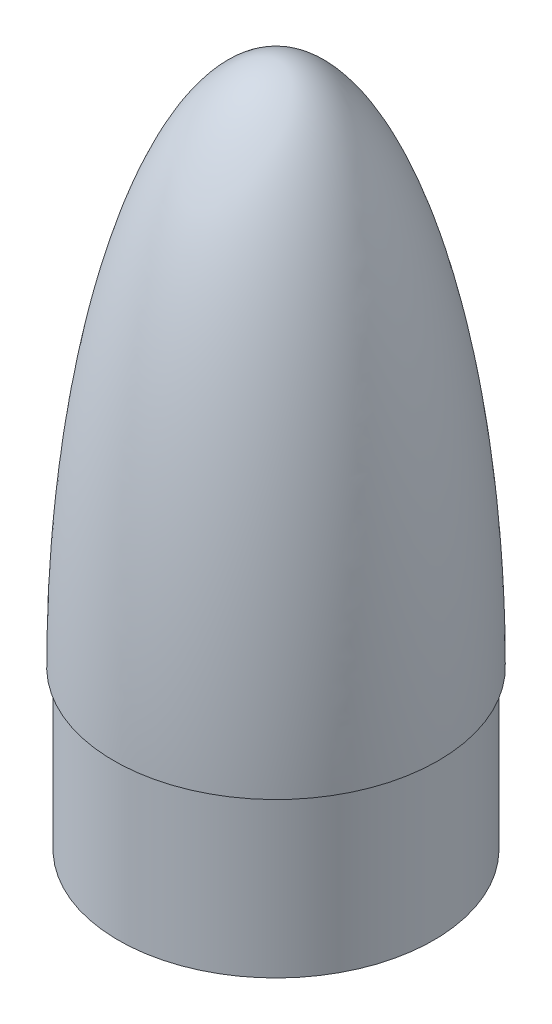
from build123d import *

# Parameters (mm, degrees)
SKETCH2_R           = 76.2
BOSS_EXTRUDE1_DEPTH = 76.2
SKETCH4_R           = 17.78
CUT_EXTRUDE1_DEPTH  = 96.52
CUT_EXTRUDE2_START  = 106.68
SKETCH5_R           = 8.255
CUT_EXTRUDE2_DEPTH  = 119.38
CUT_EXTRUDE3_START  = -25.4
SKETCH19_R          = 15.24
CUT_EXTRUDE3_DEPTH  = 101.6
SKETCH21_R          = 2.54
CUT_EXTRUDE4_DEPTH  = 6.35
SKETCH22_R          = 3
CUT_EXTRUDE5_DEPTH  = 12.7


with BuildPart() as part:
    # Sketch1 → Revolve1 (revolve)
    with BuildSketch(Plane.XY):
        with BuildLine():
            Line((78.359, 0), (0, 0))
            Line((0, 0), (0, 254))
            add(Edge.make_bspline(
                [(78.359, 0), (78.359, 0.547287489), (78.357845602, 1.649563618), (78.352650776, 3.586349875), (78.338796346, 5.988934596), (78.318010672, 8.352211569), (78.29028895, 10.745600888), (78.246958697, 13.731411826), (78.181061307, 17.311703382), (78.08386626, 21.490442467), (77.944822085, 26.264117007), (77.777683186, 31.037557631), (77.58229134, 35.809557456), (77.358460439, 40.580511863), (77.042853487, 46.542286246), (76.679080298, 52.501436144), (76.266448568, 58.457359127), (75.804102806, 64.409607399), (75.404015228, 69.168949637), (74.865626928, 75.114798701), (74.157385744, 82.243973993), (73.238266918, 90.551730955), (72.055740597, 100.030771811), (70.735528943, 109.491671534), (69.270929118, 118.931305028), (67.249996919, 130.699881306), (64.501732948, 144.763840427), (61.308555538, 158.735984092), (57.591049496, 172.577213574), (53.383025938, 186.275905479), (49.238746312, 198.044837449), (44.48323743, 209.587335711), (38.942884235, 220.71924179), (34.256173135, 228.693595393), (29.818710248, 235.095423042), (25.624249732, 240.182852143), (21.978892835, 243.926180276), (18.570150197, 246.859542723), (15.474349081, 249.076247661), (12.563405711, 250.785701438), (9.772327363, 252.083533871), (7.063069709, 253.028642362), (4.275373805, 253.686778481), (2.188006886, 253.939891173), (0.767171586, 253.999916555), (0, 254)],
                knots=[0.083290168, 0.083290168, 0.083290168, 0.083290168, 0.083290168, 0.091119674, 0.09894918, 0.106778686, 0.114608192, 0.122437698, 0.130267203, 0.145926215, 0.161585227, 0.177244239, 0.192903251, 0.208562263, 0.224221275, 0.239880287, 0.27119831, 0.286857322, 0.302516334, 0.318175346, 0.333834359, 0.365152383, 0.396470407, 0.42778843, 0.459106453, 0.490424474, 0.521742495, 0.584378539, 0.647014581, 0.678332609, 0.709650637, 0.772286631, 0.810589211, 0.841907031, 0.872607503, 0.893486158, 0.91262845, 0.928287274, 0.941044948, 0.952387223, 0.962498308, 0.97249612, 0.981348672, 0.989949856, 1, 1, 1, 1, 1], degree=4))
        make_face()
    revolve(axis=Axis((0, 254, 0), (0, -1, 0)))

    # Sketch2 → Boss-Extrude1 (add)
    with BuildSketch(Plane.XZ):
        Circle(SKETCH2_R)
    extrude(amount=BOSS_EXTRUDE1_DEPTH)

    # Sketch4 → Cut-Extrude1 (cut)
    with BuildSketch(Plane(origin=(0, 0, 0), x_dir=(1, 0, 0), z_dir=(0, 1, 0))):
        with Locations((48.26, 0)):
            Circle(SKETCH4_R)
        with Locations((0, -48.26)):
            Circle(SKETCH4_R)
        with Locations((-48.26, 0)):
            Circle(SKETCH4_R)
        with Locations((0, 48.26)):
            Circle(SKETCH4_R)
    extrude(amount=CUT_EXTRUDE1_DEPTH, mode=Mode.SUBTRACT)

    # Sketch5 → Cut-Extrude2 (cut)
    with BuildSketch(Plane(origin=(0, 0, 0), x_dir=(1, 0, 0), z_dir=(0, 1, 0)).offset(CUT_EXTRUDE2_START)):
        with Locations((20.32, 0)):
            Circle(SKETCH5_R)
        with Locations((10.16, -17.597636205)):
            Circle(SKETCH5_R)
        with Locations((-10.16, -17.597636205)):
            Circle(SKETCH5_R)
        with Locations((-20.32, 0)):
            Circle(SKETCH5_R)
        with Locations((-10.16, 17.597636205)):
            Circle(SKETCH5_R)
        with Locations((10.16, 17.597636205)):
            Circle(SKETCH5_R)
    extrude(amount=CUT_EXTRUDE2_DEPTH, mode=Mode.SUBTRACT)

    # Sketch6 → Cut-Revolve2 (revolve, cut)
    with BuildSketch(Plane.XY):
        Polygon((-30.48, 96.52), (-48.26, 117.709378876), (-48.26, 96.52), align=None)
    revolve(axis=Axis((-48.26, 96.52, 0), (0, -1, 0)), mode=Mode.SUBTRACT)

    # Sketch8 → Cut-Revolve4 (revolve, cut)
    with BuildSketch(Plane.XY.offset(48.26)):
        Polygon((0, 96.52), (17.78, 96.52), (0, 117.709378876), align=None)
    revolve(axis=Axis((0, 96.52, 48.26), (0, -1, 0)), mode=Mode.SUBTRACT)

    # Sketch9 → Cut-Revolve5 (revolve, cut)
    with BuildSketch(Plane.XY):
        Polygon((48.26, 96.52), (66.04, 96.52), (48.26, 117.709378876), align=None)
    revolve(axis=Axis((48.26, 96.52, 0), (0, -1, 0)), mode=Mode.SUBTRACT)

    # Sketch11 → Cut-Revolve6 (revolve, cut)
    with BuildSketch(Plane.XY.offset(-48.26)):
        Polygon((0, 96.52), (17.78, 96.52), (0, 117.709378876), align=None)
    revolve(axis=Axis((0, 96.52, -48.26), (0, -1, 0)), mode=Mode.SUBTRACT)

    # Sketch12 → Cut-Revolve7 (revolve, cut)
    with BuildSketch(Plane.XY):
        Polygon((-20.32, 226.06), (-12.065, 226.06), (-20.32, 235.897925907), align=None)
    revolve(axis=Axis((-20.32, 226.06, 0), (0, -1, 0)), mode=Mode.SUBTRACT)

    # Sketch14 → Cut-Revolve8 (revolve, cut)
    with BuildSketch(Plane.XY):
        Polygon((20.32, 226.06), (28.575, 226.06), (20.32, 235.897925907), align=None)
    revolve(axis=Axis((20.32, 235.897925907, 0), (0, -1, 0)), mode=Mode.SUBTRACT)

    # Sketch15 → Cut-Revolve9 (revolve, cut)
    with BuildSketch(Plane.XY.offset(17.597636205)):
        Polygon((-10.16, 226.06), (-1.905, 226.06), (-10.16, 235.897925907), align=None)
    revolve(axis=Axis((-10.16, 226.06, 17.597636205), (0, -1, 0)), mode=Mode.SUBTRACT)

    # Sketch16 → Cut-Revolve10 (revolve, cut)
    with BuildSketch(Plane.XY.offset(17.597636205)):
        Polygon((10.16, 226.06), (18.415, 226.06), (10.16, 235.897925907), align=None)
    revolve(axis=Axis((10.16, 235.897925907, 17.597636205), (0, -1, 0)), mode=Mode.SUBTRACT)

    # Sketch17 → Cut-Revolve11 (revolve, cut)
    with BuildSketch(Plane.XY.offset(-17.597636205)):
        Polygon((10.16, 226.06), (18.415, 226.06), (10.16, 235.897925907), align=None)
    revolve(axis=Axis((10.16, 235.897925907, -17.597636205), (0, -1, 0)), mode=Mode.SUBTRACT)

    # Sketch18 → Cut-Revolve12 (revolve, cut)
    with BuildSketch(Plane.XY.offset(-17.597636205)):
        Polygon((-10.16, 226.06), (-1.905, 226.06), (-10.16, 235.897925907), align=None)
    revolve(axis=Axis((-10.16, 235.897925907, -17.597636205), (0, -1, 0)), mode=Mode.SUBTRACT)

    # Sketch19 → Cut-Extrude3 (cut)
    with BuildSketch(Plane(origin=(0, 0, 0), x_dir=(1, 0, 0), z_dir=(0, 1, 0)).offset(CUT_EXTRUDE3_START)):
        Circle(SKETCH19_R)
    extrude(amount=CUT_EXTRUDE3_DEPTH, mode=Mode.SUBTRACT)

    # Sketch20 → Cut-Revolve13 (revolve, cut)
    with BuildSketch(Plane.XY):
        Polygon((0, 76.2), (15.24, 76.2), (0, 94.362324751), align=None)
    revolve(axis=Axis((0, 270.51, 0), (0, -1, 0)), mode=Mode.SUBTRACT)

    # Sketch21 → Cut-Extrude4 (cut)
    with BuildSketch(Plane.XZ.offset(76.2)):
        with Locations((-44.16298, 0)):
            Circle(SKETCH21_R)
        with Locations((0, 44.16298)):
            Circle(SKETCH21_R)
        with Locations((44.16298, 0)):
            Circle(SKETCH21_R)
        with Locations((0, -44.16298)):
            Circle(SKETCH21_R)
    extrude(amount=-CUT_EXTRUDE4_DEPTH, mode=Mode.SUBTRACT)

    # Sketch22 → Cut-Extrude5 (cut)
    with BuildSketch(Plane.XZ.offset(76.2)):
        with Locations((-35.921024484, -35.921024484)):
            Circle(SKETCH22_R)
        with Locations((-35.921024484, 35.921024484)):
            Circle(SKETCH22_R)
        with Locations((35.921024484, 35.921024484)):
            Circle(SKETCH22_R)
        with Locations((35.921024484, -35.921024484)):
            Circle(SKETCH22_R)
    extrude(amount=-CUT_EXTRUDE5_DEPTH, mode=Mode.SUBTRACT)

    # Sketch3 → Cut-Revolve1 (revolve, cut)
    with BuildSketch(Plane.XY):
        with BuildLine():
            Line((0, 0), (50.695639171, 0))
            ThreePointArc((50.695639171, 0), (37.521185782, 66.292890616), (0, 122.510985441))
            Line((0, 122.510985441), (0, 0))
        make_face()
    revolve(axis=Axis((0, 270.51, 0), (0, -1, 0)), mode=Mode.SUBTRACT)


solid = part.part
